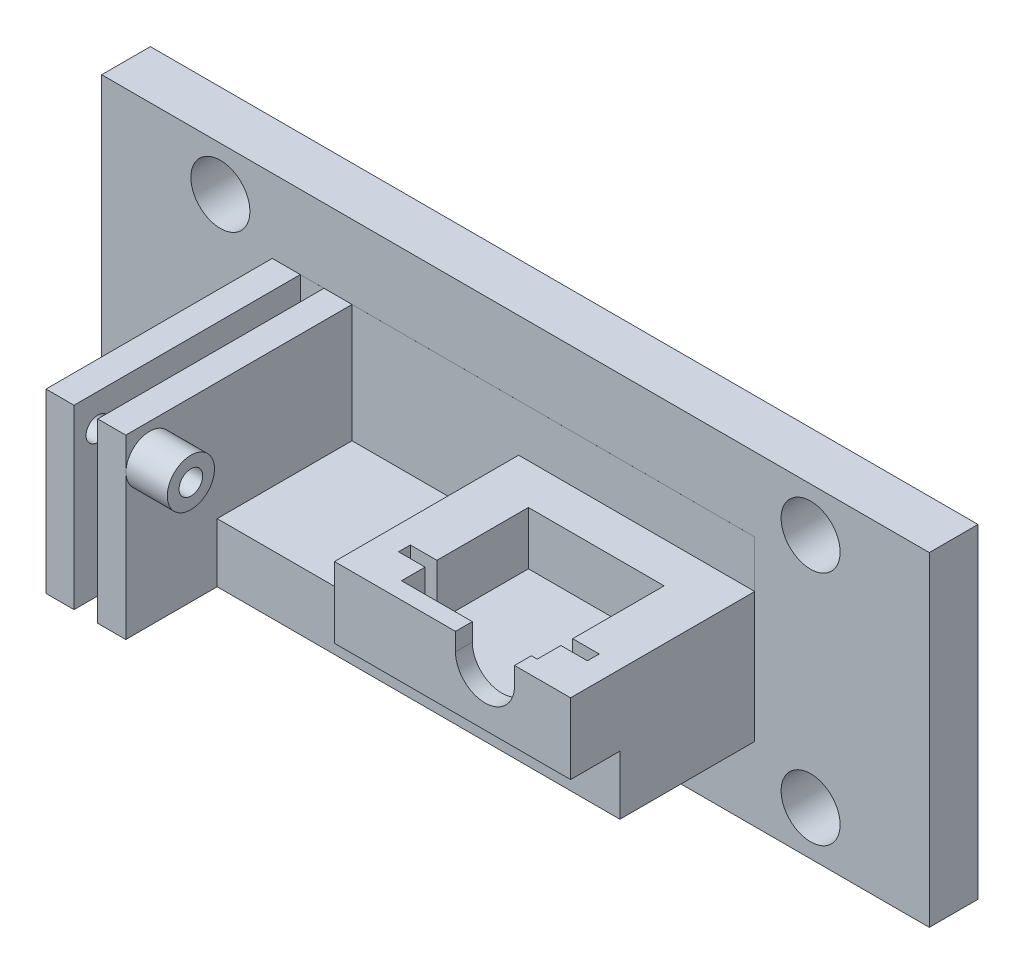
from build123d import *

# Parameters (mm, degrees)
SKETCH1_W                       = 40
SKETCH1_H                       = 35
BOSS_EXTRUDE1_DEPTH             = 18
CAVITY1_START                   = -14.401086919
CAVITY1_OUTLINE_W               = 23
CAVITY1_OUTLINE_H               = 12
CAVITY1_DEPTH                   = 21.5
CAVITY1_START_2                 = 7.098913081
CAVITY1_2_OUTLINE_R             = 5
CAVITY1_2_DEPTH                 = 3
CAVITY1_START_3                 = 1.098913081
CAVITY1_3_DEPTH                 = 2
CAVITY1_START_4                 = 10.098913081
CAVITY1_4_OUTLINE_R             = 2.5
CAVITY1_4_DEPTH                 = 4
CUT_EXTRUDE1_DEPTH              = 42.733432002
CUT_EXTRUDE1_DEPTH_BACK         = 42.733432002
SKETCH2_W                       = 52.530025258
SKETCH2_H                       = 12.54309889
CUT_EXTRUDE2_DEPTH              = 43
SKETCH4_W                       = 40
SKETCH4_H                       = 7.548254148
CUT_EXTRUDE3_DEPTH              = 43
BOSS_EXTRUDE2_DEPTH             = 3
SKETCH6_W                       = 81.743347259
SKETCH6_H                       = 13.911125845
BOSS_EXTRUDE3_DEPTH             = 10
SKETCH8_W                       = 4.746846532
SKETCH8_H                       = 29.399300547
BOSS_EXTRUDE4_DEPTH             = 20
BOSS_EXTRUDE4_DIRECTION_2_REACH = 67.288
SKETCH9_R                       = 2
CUT_EXTRUDE4_DEPTH              = 34
SKETCH10_R                      = 4
SKETCH10_R_2                    = 2
BOSS_EXTRUDE5_DEPTH             = 7
BOSS_EXTRUDE6_DEPTH             = 5.186094658
BOSS_EXTRUDE7_DEPTH             = 12
SKETCH14_W                      = 81.743347259
SKETCH14_H                      = 8.25177529
BOSS_EXTRUDE8_DEPTH             = 20
SKETCH16_W                      = 140.221979832
SKETCH16_H                      = 55
BOSS_EXTRUDE9_DEPTH             = 8.25
SKETCH17_R                      = 5
CUT_EXTRUDE5_DEPTH              = 10


# Read off the part's stored shape, not the designer's step: Cavity1
with BuildPart() as part:
    # Sketch1 → Boss-Extrude1 (new body)
    with BuildSketch(Plane(origin=(0, 0, 0), x_dir=(1, 0, 0), z_dir=(0, 1, 0))):
        Rectangle(SKETCH1_W, SKETCH1_H)
    extrude(amount=BOSS_EXTRUDE1_DEPTH)

    # Cavity1 outline → Cavity1 (cut)
    with BuildSketch(Plane.XY.offset(CAVITY1_START)):
        with Locations((0, 9)):
            Rectangle(CAVITY1_OUTLINE_W, CAVITY1_OUTLINE_H)
    extrude(amount=CAVITY1_DEPTH, mode=Mode.SUBTRACT)

    # Cavity1 2 outline → Cavity1 2 (cut)
    with BuildSketch(Plane.XY.offset(CAVITY1_START_2)):
        with Locations((5.5, 9)):
            Circle(CAVITY1_2_OUTLINE_R)
    extrude(amount=CAVITY1_2_DEPTH, mode=Mode.SUBTRACT)

    # Cavity1 3 outline → Cavity1 3 (cut)
    with BuildSketch(Plane.XY.offset(CAVITY1_START_3)):
        with BuildLine():
            Line((-11.5, 15), (-16, 15))
            Line((-16, 15), (-16, 10.821261352))
            Line((-16, 10.821261352), (-14.337589365, 10.821261352))
            ThreePointArc((-14.337589365, 10.821261352), (-12.516328014, 9), (-14.337589365, 7.178738648))
            Line((-14.337589365, 7.178738648), (-16, 7.178738648))
            Line((-16, 7.178738648), (-16, 3))
            Line((-16, 3), (-11.5, 3))
            Line((-11.5, 3), (-11.5, 15))
        make_face()
        with BuildLine():
            Line((16, 15), (11.5, 15))
            Line((11.5, 15), (11.5, 3))
            Line((11.5, 3), (16, 3))
            Line((16, 3), (16, 7.178738648))
            Line((16, 7.178738648), (14.337589365, 7.178738648))
            ThreePointArc((14.337589365, 7.178738648), (12.516328014, 9), (14.337589365, 10.821261352))
            Line((14.337589365, 10.821261352), (16, 10.821261352))
            Line((16, 10.821261352), (16, 15))
        make_face()
    extrude(amount=CAVITY1_3_DEPTH, mode=Mode.SUBTRACT)

    # Cavity1 4 outline → Cavity1 4 (cut)
    with BuildSketch(Plane.XY.offset(CAVITY1_START_4)):
        with Locations((5.5, 9)):
            Circle(CAVITY1_4_OUTLINE_R)
    extrude(amount=CAVITY1_4_DEPTH, mode=Mode.SUBTRACT)

    # Sketch2 → Cut-Extrude1 (cut, two sides: drawn at the far end of the back side and taken through both)
    with BuildSketch(Plane.XY.offset(-14.401086919).offset(-CUT_EXTRUDE1_DEPTH_BACK)):
        with Locations((5.5, 15.271549445)):
            Rectangle(SKETCH2_W, SKETCH2_H)
    extrude(amount=CUT_EXTRUDE1_DEPTH + CUT_EXTRUDE1_DEPTH_BACK, mode=Mode.SUBTRACT)

    # Sketch3 → Cut-Extrude2 (cut)
    with BuildSketch(Plane(origin=(0, 3, 0), x_dir=(1, 0, 0), z_dir=(0, 1, 0))):
        Polygon((-11.5, -3.098913081), (-11.5, -7.098913081), (11.5, -7.098913081), (11.5, -3.098913081), (16, -3.098913081), (16, -1.098913081), (11.5, -1.098913081), (11.5, 14.401086919), (-11.5, 14.401086919), (-11.5, -1.098913081), (-16, -1.098913081), (-16, -3.098913081), align=None)
    extrude(amount=CUT_EXTRUDE2_DEPTH, mode=Mode.SUBTRACT)

    # Sketch4 → Cut-Extrude3 (cut)
    with BuildSketch(Plane(origin=(0, 9, 0), x_dir=(1, 0, 0), z_dir=(0, 1, 0))):
        with Locations((0, -13.725872926)):
            Rectangle(SKETCH4_W, SKETCH4_H)
    extrude(amount=-CUT_EXTRUDE3_DEPTH, mode=Mode.SUBTRACT)

    # Sketch5 → Boss-Extrude2 (add)
    with BuildSketch(Plane(origin=(0, 9, 0), x_dir=(1, 0, 0), z_dir=(0, 1, 0))):
        Polygon((10.5, -9.951745852), (20, -9.951745852), (20, 17.5), (-20, 17.5), (-20, -9.951745852), (0.5, -9.951745852), (0.5, -7.098913081), (-11.5, -7.098913081), (-11.5, -3.098913081), (-16, -3.098913081), (-16, -1.098913081), (-11.5, -1.098913081), (-11.5, 14.401086919), (11.5, 14.401086919), (11.5, -1.098913081), (16, -1.098913081), (16, -3.098913081), (11.5, -3.098913081), (11.5, -7.098913081), (10.5, -7.098913081), align=None)
    extrude(amount=BOSS_EXTRUDE2_DEPTH)

    # Sketch6 → Boss-Extrude3 (add)
    with BuildSketch(Plane.XZ):
        with Locations((-20.87167363, -5.358342419)):
            Rectangle(SKETCH6_W, SKETCH6_H)
    extrude(amount=BOSS_EXTRUDE3_DEPTH)

    # Sketch8 → Boss-Extrude4 (add)
    with BuildSketch(Plane(origin=(0, 0, 0), x_dir=(1, 0, 0), z_dir=(0, 1, 0))):
        with Locations((-59.369923993, -2.385744932)):
            Rectangle(SKETCH8_W, SKETCH8_H)
        with Locations((-50.602645133, -2.385744932)):
            Rectangle(SKETCH8_W, SKETCH8_H)
    extrude(amount=BOSS_EXTRUDE4_DEPTH)

    # Boss-Extrude4 direction 2: up to this face of the body (flat: up to its plane)
    boss_extrude4_direction_2_end = Plane(part.part.faces().sort_by_distance((-20.87167363, -10, -5.358342419))[0])
    # Sketch8 → Boss-Extrude4 direction 2 (add, up to the picked face)
    with BuildSketch(Plane(origin=(0, 0, 0), x_dir=(1, 0, 0), z_dir=(0, 1, 0)), mode=Mode.PRIVATE) as boss_extrude4_direction_2_sk1:
        with Locations((-59.369923993, -2.385744932)):
            Rectangle(SKETCH8_W, SKETCH8_H)
    boss_extrude4_direction_2_tool1 = split(extrude(boss_extrude4_direction_2_sk1.sketch, amount=-BOSS_EXTRUDE4_DIRECTION_2_REACH, mode=Mode.PRIVATE), bisect_by=boss_extrude4_direction_2_end, keep=Keep.BOTH, mode=Mode.PRIVATE)
    # Sketch8 → Boss-Extrude4 direction 2 (add, up to the picked face)
    with BuildSketch(Plane(origin=(0, 0, 0), x_dir=(1, 0, 0), z_dir=(0, 1, 0)), mode=Mode.PRIVATE) as boss_extrude4_direction_2_sk2:
        with Locations((-50.602645133, -2.385744932)):
            Rectangle(SKETCH8_W, SKETCH8_H)
    boss_extrude4_direction_2_tool2 = split(extrude(boss_extrude4_direction_2_sk2.sketch, amount=-BOSS_EXTRUDE4_DIRECTION_2_REACH, mode=Mode.PRIVATE), bisect_by=boss_extrude4_direction_2_end, keep=Keep.BOTH, mode=Mode.PRIVATE)
    add(boss_extrude4_direction_2_tool1.solids().sort_by(Axis((-59.369924, 0, 2.385745), (0, -1, 0)))[0])
    add(boss_extrude4_direction_2_tool2.solids().sort_by(Axis((-50.602645, 0, 2.385745), (0, -1, 0)))[0])

    # Sketch9 → Cut-Extrude4 (cut)
    with BuildSketch(Plane.ZY.offset(61.743347259)):
        with Locations((13.051745852, 14.536175319)):
            Circle(SKETCH9_R)
    extrude(amount=-CUT_EXTRUDE4_DEPTH, mode=Mode.SUBTRACT)

    # Sketch10 → Boss-Extrude5 (add)
    with BuildSketch(Plane(origin=(-48.229221867, 0, 0), x_dir=(0, 0, -1), z_dir=(1, 0, 0))):
        with Locations((-13.051745852, 14.536175319)):
            Circle(SKETCH10_R)
        with Locations(Location((-13.051745852, 14.536175319, 0), (0, 0, 180))):
            Circle(SKETCH10_R_2, mode=Mode.SUBTRACT)
    extrude(amount=BOSS_EXTRUDE5_DEPTH)

    # Sketch11 → Boss-Extrude6 (add)
    with BuildSketch(Plane(origin=(0, 0, -12.313905342), x_dir=(-1, 0, 0), z_dir=(0, 0, -1))):
        Polygon((61.743347259, -10), (61.743347259, 20), (56.996500727, 20), (56.996500727, 0), (52.976068399, 0), (52.976068399, 20), (48.229221867, 20), (48.229221867, 0), (20, 0), (-20, 0), (-20, -10), align=None)
    extrude(amount=BOSS_EXTRUDE6_DEPTH)

    # Sketch12 → Boss-Extrude7 (add)
    with BuildSketch(Plane(origin=(0, 0, -17.5), x_dir=(-1, 0, 0), z_dir=(0, 0, -1))):
        Polygon((20, 0), (20, 12), (-20, 12), (-20, -10), (61.743347259, -10), (61.743347259, 20), (56.996500727, 20), (56.996500727, 0), (52.976068399, 0), (52.976068399, 20), (48.229221867, 20), (48.229221867, 0), align=None)
    extrude(amount=BOSS_EXTRUDE7_DEPTH)

    # Sketch14 → Boss-Extrude8 (add)
    with BuildSketch(Plane(origin=(0, 0, 0), x_dir=(1, 0, 0), z_dir=(0, 1, 0))):
        with Locations((-20.87167363, 25.374112355)):
            Rectangle(SKETCH14_W, SKETCH14_H)
    extrude(amount=BOSS_EXTRUDE8_DEPTH)

    # Sketch16 → Boss-Extrude9 (add)
    with BuildSketch(Plane(origin=(0, 0, -29.5), x_dir=(-1, 0, 0), z_dir=(0, 0, -1))):
        with Locations((20.535780022, 5)):
            Rectangle(SKETCH16_W, SKETCH16_H)
    extrude(amount=-BOSS_EXTRUDE9_DEPTH)

    # Sketch17 → Cut-Extrude5 (cut)
    with BuildSketch(Plane(origin=(0, 0, -29.5), x_dir=(-1, 0, 0), z_dir=(0, 0, -1))):
        with Locations((-29.464219978, 25)):
            Circle(SKETCH17_R)
        with Locations((-29.464219978, -15)):
            Circle(SKETCH17_R)
        with Locations((70.535780022, 25)):
            Circle(SKETCH17_R)
        with Locations((70.535780022, -15)):
            Circle(SKETCH17_R)
    extrude(amount=-CUT_EXTRUDE5_DEPTH, mode=Mode.SUBTRACT)


solid = part.part
